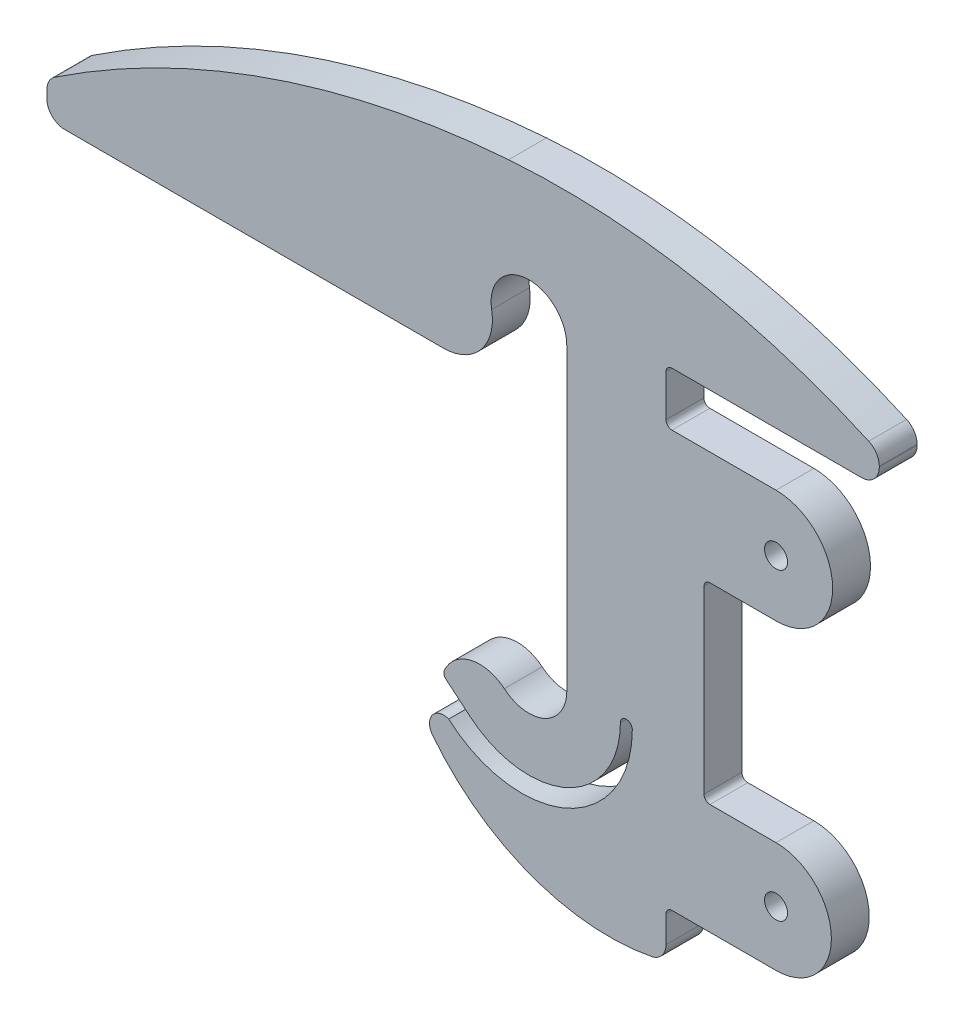
from build123d import *

# Parameters (mm, degrees)
BOSS_EXTRUDE1_DEPTH = 3.175
FILLET1_R           = 0.5
FILLET2_R           = 1.5
CUT_EXTRUDE3_REACH  = 51.643
SKETCH4_R           = 0.9652


with BuildPart() as part:
    # Model → Boss-Extrude1 (new body)
    with BuildSketch(Plane.XY):
        with BuildLine():
            Line((14.682892141, 1.324956628), (14.682892141, -14.782035516))
            Line((14.682892141, -14.782035516), (20.7298505, -14.782035516))
            ThreePointArc((20.7298505, -14.782035516), (25.372858356, -19.425043372), (20.7298505, -24.068051228))
            Line((20.7298505, -24.068051228), (11.5, -24.068051228))
            Line((11.5, -24.068051228), (11.5, -28.004155183))
            ThreePointArc((11.5, -28.004155183), (0.71022918, -27.624612518), (-8.091185045, -21.371748005))
            ThreePointArc((-8.091185045, -21.371748005), (-8.108719309, -19.937278968), (-6.731529764, -19.535585272))
            ThreePointArc((-6.731529764, -19.535585272), (3.21430247, -21.04378196), (8.674974651, -12.595391853))
            ThreePointArc((8.674974651, -12.595391853), (8.175614462, -12.09535774), (7.674976202, -12.594112234))
            ThreePointArc((7.674976202, -12.594112234), (3.234931854, -19.534945465), (-4.933394903, -18.4543911))
            Line((-4.933394903, -18.4543911), (-7.231528234, -16.526028271))
            ThreePointArc((-7.231528234, -16.526028271), (-5.055570769, -14.381233606), (-2.061467679, -14.989741395))
            ThreePointArc((-2.061467679, -14.989741395), (1.32956104, -15.458208706), (3.175, -12.575000001))
            Line((3.175, -12.575000001), (3.175, 12.575000001))
            ThreePointArc((3.175, 12.575000001), (-0.276719482, 15.737918167), (-3.126764616, 12.023667038))
            ThreePointArc((-3.126764616, 12.023667038), (-4.027590212, 8.661740144), (-7.182015159, 7.190807634))
            Line((-7.182015159, 7.190807634), (-38.940555286, 7.190807634))
            ThreePointArc((-38.940555286, 7.190807634), (-40.001215458, 7.630147462), (-40.440555286, 8.690807634))
            Line((-40.440555286, 8.690807634), (-40.440555286, 9.332781994))
            ThreePointArc((-40.440555286, 9.332781994), (-40.26291966, 10.040844464), (-39.772085337, 10.581204108))
            ThreePointArc((-39.772085337, 10.581204108), (-21.582497329, 19.5655863), (-1.704175076, 23.619293202))
            ThreePointArc((-1.704175076, 23.619293202), (14.213621823, 22.738093196), (29.39280733, 17.865198893))
            Line((29.39280733, 17.865198893), (29.39280733, 15.324956628))
            Line((29.39280733, 15.324956628), (11.5, 15.324956628))
            Line((11.5, 15.324956628), (11.5, 10.824956628))
            Line((11.5, 10.824956628), (20.7298505, 10.824956628))
            ThreePointArc((20.7298505, 10.824956628), (25.4798505, 6.074956628), (20.7298505, 1.324956628))
            Line((20.7298505, 1.324956628), (14.682892141, 1.324956628))
        make_face()
    extrude(amount=BOSS_EXTRUDE1_DEPTH)

    # Fillet1
    fillet1_edges = [part.edges().sort_by_distance(p)[0] for p in [
        (-7.231528234, -16.526028271, 1.5875),
        (11.5, 10.824956628, 1.5875),
        (11.5, 15.324956628, 1.5875),
        (14.682892141, 1.324956628, 1.5875),
        (14.682892141, -14.782035516, 1.5875),
        (11.5, -24.068051228, 1.5875),
    ]]
    fillet(fillet1_edges, radius=FILLET1_R)

    # Fillet2
    fillet2_edges = [part.edges().sort_by_distance(p)[0] for p in [
        (29.39280733, 15.324956628, 1.5875),
        (29.39280733, 17.865198893, 1.5875),
        (11.5, -28.004155183, 1.5875),
    ]]
    fillet(fillet2_edges, radius=FILLET2_R)

    # Sketch4 → Cut-Extrude3 (cut, up to next)
    with BuildSketch(Plane.XY.offset(3.175), mode=Mode.PRIVATE) as cut_extrude3_sk1:
        with Locations((20.7298505, 6.074956628)):
            Circle(SKETCH4_R)
    cut_extrude3_tool1 = extrude(cut_extrude3_sk1.sketch, amount=-CUT_EXTRUDE3_REACH, mode=Mode.PRIVATE) & part.part
    # Sketch4 → Cut-Extrude3 (cut, up to next)
    with BuildSketch(Plane.XY.offset(3.175), mode=Mode.PRIVATE) as cut_extrude3_sk2:
        with Locations((20.7298505, -19.425043372)):
            Circle(SKETCH4_R)
    cut_extrude3_tool2 = extrude(cut_extrude3_sk2.sketch, amount=-CUT_EXTRUDE3_REACH, mode=Mode.PRIVATE) & part.part
    add(cut_extrude3_tool1.solids().sort_by_distance((20.729851, 6.074957, 3.175))[0], mode=Mode.SUBTRACT)
    add(cut_extrude3_tool2.solids().sort_by_distance((20.729851, -19.425043, 3.175))[0], mode=Mode.SUBTRACT)


solid = part.part
